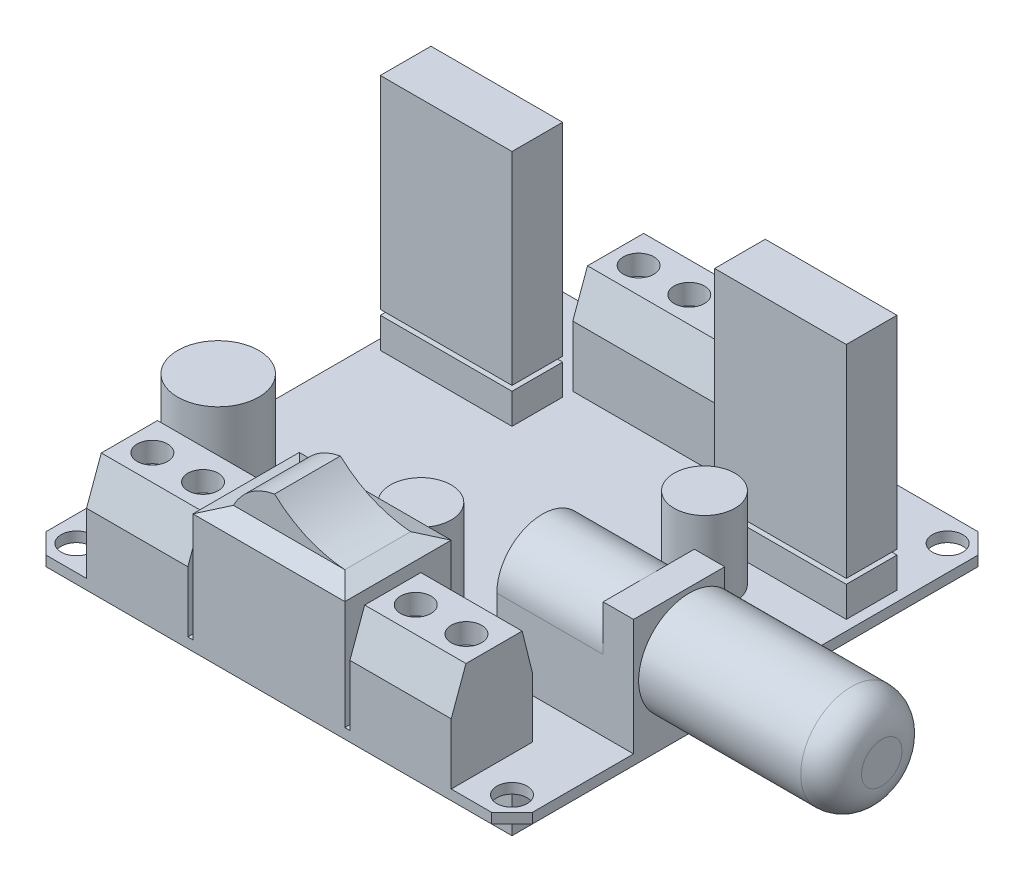
from build123d import *

# Parameters (mm, degrees)
SKETCH_2_W           = 48
SKETCH_2_H           = 48
SKETCH_2_R           = 1.5
EXTRUDE_1_DEPTH      = 5
SKETCH_3_W           = 48
SKETCH_3_H           = 48
SKETCH_3_W_2         = 40
SKETCH_3_H_2         = 40
CUT_EXTRUDE_1_DEPTH  = 4
SKETCH_4_W           = 20
SKETCH_4_H           = 8
EXTRUDE_2_DEPTH      = 10
SKETCH_5_R           = 1.5
CUT_EXTRUDE_2_DEPTH  = 2
CHAMFER_1_SIZE       = 4
CHAMFER_1_SIZE2      = 1.000278651
CHAMFER_2_SIZE       = 4
CHAMFER_2_SIZE2      = 1.455880937
SKETCH_11_W          = 13.5
SKETCH_11_H          = 9
EXTRUDE_5_DEPTH      = 11.5
CUT_EXTRUDE_3_DEPTH  = 10.5
SKETCH_13_R          = 2.25
EXTRUDE_7_DEPTH      = 1
SKETCH_14_R          = 5
EXTRUDE_8_DEPTH      = 19
FILLET_1_R           = 3
SKETCH_15_W          = 15
SKETCH_15_H          = 10.5
EXTRUDE_9_DEPTH      = 11.5
CHAMFER_3_SIZE       = 2
CHAMFER_3_SIZE2      = 0.727940469
SKETCH_16_W          = 11
SKETCH_16_H          = 6.5
EXTRUDE_10_DEPTH     = 3
CUT_EXTRUDE_4_REACH  = 68.575
SKETCH_18_W          = 10
SKETCH_18_H          = 8
EXTRUDE_11_DEPTH     = 10
SKETCH_19_R          = 1.5
CUT_EXTRUDE_5_DEPTH  = 2
CHAMFER_4_SIZE       = 4
CHAMFER_4_SIZE2      = 0.997312011
CHAMFER_5_SIZE       = 4
CHAMFER_5_SIZE2      = 1.455880937
MIRROR_START         = 5
MIRROR_3_OUTLINE_W   = 10
MIRROR_3_OUTLINE_H   = 8
MIRROR_3_DEPTH       = 6
MIRROR_START_2       = 10.766127047
MIRROR_3_2_OUTLINE_R = 1.5
MIRROR_3_2_DEPTH     = 2.233872953
MIRROR_START_3       = -18
MIRROR_3_3_DEPTH     = 10
MIRROR_START_4       = 13
MIRROR_3_4_OUTLINE_R = 1.5
MIRROR_3_4_DEPTH     = 2
SKETCH_20_W          = 13
SKETCH_20_H          = 5
EXTRUDE_12_DEPTH     = 3
SKETCH_21_W          = 0.6
SKETCH_21_H          = 0.8
EXTRUDE_13_DEPTH     = 5.5
SKETCH_22_R          = 4
EXTRUDE_14_DEPTH     = 10
SKETCH_23_R          = 3
EXTRUDE_15_DEPTH     = 8
CHAMFER_6_SIZE       = 2
SKETCH_25_W          = 13
SKETCH_25_H          = 5
EXTRUDE_17_DEPTH     = 20


with BuildPart() as part:
    # 草图2 → 凸台-拉伸1 (new body)
    with BuildSketch(Plane(origin=(0, 0, 0), x_dir=(1, 0, 0), z_dir=(0, 1, 0))):
        Rectangle(SKETCH_2_W, SKETCH_2_H)
        with Locations(Location((-21.5, 21.5, 0), (0, 0, 270))):
            Circle(SKETCH_2_R, mode=Mode.SUBTRACT)
        with Locations(Location((21.5, 21.5, 0), (0, 0, 270))):
            Circle(SKETCH_2_R, mode=Mode.SUBTRACT)
        with Locations(Location((-21.5, -21.5, 0), (0, 0, 270))):
            Circle(SKETCH_2_R, mode=Mode.SUBTRACT)
        with Locations(Location((21.5, -21.5, 0), (0, 0, 270))):
            Circle(SKETCH_2_R, mode=Mode.SUBTRACT)
    extrude(amount=EXTRUDE_1_DEPTH)

    # 草图3 → 切除-拉伸1 (cut)
    with BuildSketch(Plane.XZ):
        Rectangle(SKETCH_3_W, SKETCH_3_H)
        Rectangle(SKETCH_3_W_2, SKETCH_3_H_2, mode=Mode.SUBTRACT)
    extrude(amount=-CUT_EXTRUDE_1_DEPTH, mode=Mode.SUBTRACT)

    # 草图4 → 凸台-拉伸2 (add)
    with BuildSketch(Plane(origin=(0, 5, 0), x_dir=(1, 0, 0), z_dir=(0, 1, 0))):
        with Locations((0, 20)):
            Rectangle(SKETCH_4_W, SKETCH_4_H)
    extrude(amount=EXTRUDE_2_DEPTH)

    # 草图5 → 切除-拉伸2 (cut)
    with BuildSketch(Plane(origin=(0, 15, 0), x_dir=(1, 0, 0), z_dir=(0, 1, 0))):
        with Locations(Location((-7.5, 20, 0), (0, 0, 270))):
            Circle(SKETCH_5_R)
        with Locations(Location((-2.5, 20, 0), (0, 0, 270))):
            Circle(SKETCH_5_R)
        with Locations(Location((2.5, 20, 0), (0, 0, 270))):
            Circle(SKETCH_5_R)
        with Locations(Location((7.5, 20, 0), (0, 0, 270))):
            Circle(SKETCH_5_R)
    extrude(amount=-CUT_EXTRUDE_2_DEPTH, mode=Mode.SUBTRACT)

    # 倒角1
    chamfer_1_edges = [part.edges().sort_by_distance(p)[0] for p in [
        (0, 15, -24),
    ]]
    chamfer_1_side = [part.faces().sort_by_distance(p)[0] for p in [
        (0, 8.935483871, -24),
    ]]
    chamfer(chamfer_1_edges, length=CHAMFER_1_SIZE, length2=CHAMFER_1_SIZE2, reference=chamfer_1_side[0])

    # 倒角2
    chamfer_2_edges = [part.edges().sort_by_distance(p)[0] for p in [
        (0, 15, -16),
    ]]
    chamfer_2_side = [part.faces().sort_by_distance(p)[0] for p in [
        (0, 10, -16),
    ]]
    chamfer(chamfer_2_edges, length=CHAMFER_2_SIZE, length2=CHAMFER_2_SIZE2, reference=chamfer_2_side[0])

    # 草图11 → 凸台-拉伸5 (add)
    with BuildSketch(Plane(origin=(0, 5, 0), x_dir=(1, 0, 0), z_dir=(0, 1, 0))):
        with Locations((17.25, -7.5)):
            Rectangle(SKETCH_11_W, SKETCH_11_H)
    extrude(amount=EXTRUDE_5_DEPTH)

    # 草图12 → 切除-拉伸3 (cut)
    with BuildSketch(Plane.ZY.offset(-10.5)):
        with BuildLine():
            ThreePointArc((7.5, 16.5), (10.681980515, 15.181980515), (12, 12))
            Line((12, 12), (12, 16.5))
            Line((12, 16.5), (7.5, 16.5))
        make_face()
        with BuildLine():
            Line((3, 16.5), (3, 12))
            ThreePointArc((3, 12), (4.318019485, 15.181980515), (7.5, 16.5))
            Line((7.5, 16.5), (3, 16.5))
        make_face()
    extrude(amount=-CUT_EXTRUDE_3_DEPTH, mode=Mode.SUBTRACT)

    # 草图13 → 凸台-拉伸7 (add)
    with BuildSketch(Plane(origin=(24, 0, 0), x_dir=(0, 0, -1), z_dir=(1, 0, 0))):
        with Locations(Location((-7.5, 12, 0), (0, 0, 180))):
            Circle(SKETCH_13_R)
    extrude(amount=EXTRUDE_7_DEPTH)

    # 草图14 → 凸台-拉伸8 (add)
    with BuildSketch(Plane(origin=(25, 0, 0), x_dir=(0, 0, -1), z_dir=(1, 0, 0))):
        with Locations((-7.5, 12)):
            Circle(SKETCH_14_R)
    extrude(amount=EXTRUDE_8_DEPTH)

    # 圆角1
    fillet_1_edges = [part.edges().sort_by_distance(p)[0] for p in [
        (44, 12, 12.5),
    ]]
    fillet(fillet_1_edges, radius=FILLET_1_R)

    # 草图15 → 凸台-拉伸9 (add)
    with BuildSketch(Plane(origin=(0, 5, 0), x_dir=(1, 0, 0), z_dir=(0, 1, 0))):
        with Locations((0, -18.75)):
            Rectangle(SKETCH_15_W, SKETCH_15_H)
    extrude(amount=EXTRUDE_9_DEPTH)

    # 倒角3
    chamfer_3_edges = [part.edges().sort_by_distance(p)[0] for p in [
        (-7.5, 16.5, 18.75),
        (0, 16.5, 24),
        (7.5, 16.5, 18.75),
        (0, 16.5, 13.5),
    ]]
    chamfer_3_side = [part.faces().sort_by_distance(p)[0] for p in [
        (0, 16.5, 18.75),
    ]]
    chamfer(chamfer_3_edges, length=CHAMFER_3_SIZE, length2=CHAMFER_3_SIZE2, reference=chamfer_3_side[0])

    # 草图16 → 凸台-拉伸10 (add)
    with BuildSketch(Plane(origin=(0, 16.5, 0), x_dir=(1, 0, 0), z_dir=(0, 1, 0))):
        with Locations((0, -18.75)):
            Rectangle(SKETCH_16_W, SKETCH_16_H)
    extrude(amount=EXTRUDE_10_DEPTH)

    # 草图17 → 切除-拉伸4 (cut, up to next)
    with BuildSketch(Plane.XY.offset(22), mode=Mode.PRIVATE) as cut_extrude_4_sk1:
        with BuildLine():
            Line((-5.5, 19.5), (-5.5, 16.5))
            add(Edge.make_bspline(
                [(-1.439483258, 19.5), (-4.204331389, 18.963135073), (-5.5, 16.5)],
                knots=[0, 0, 0, 1, 1, 1], degree=2))
            Line((-1.439483258, 19.5), (-5.5, 19.5))
        make_face()
    cut_extrude_4_tool1 = extrude(cut_extrude_4_sk1.sketch, amount=-CUT_EXTRUDE_4_REACH, mode=Mode.PRIVATE) & part.part
    # 草图17 → 切除-拉伸4 (cut, up to next)
    with BuildSketch(Plane.XY.offset(22), mode=Mode.PRIVATE) as cut_extrude_4_sk2:
        with BuildLine():
            add(Edge.make_bspline(
                [(-1.439483258, 19.5), (1.468647393, 16.819501046), (5.5, 16.5)],
                knots=[0, 0, 0, 1, 1, 1], degree=2))
            Line((5.5, 16.5), (5.5, 19.5))
            Line((5.5, 19.5), (-1.439483258, 19.5))
        make_face()
    cut_extrude_4_tool2 = extrude(cut_extrude_4_sk2.sketch, amount=-CUT_EXTRUDE_4_REACH, mode=Mode.PRIVATE) & part.part
    add(cut_extrude_4_tool1.solids().sort_by_distance((-4.412969, 18.65459, 22))[0], mode=Mode.SUBTRACT)
    add(cut_extrude_4_tool2.solids().sort_by_distance((2.881938, 18.323125, 22))[0], mode=Mode.SUBTRACT)

    # 草图18 → 凸台-拉伸11 (add)
    with BuildSketch(Plane(origin=(0, 5, 0), x_dir=(1, 0, 0), z_dir=(0, 1, 0))):
        with Locations((13, -20)):
            Rectangle(SKETCH_18_W, SKETCH_18_H)
    extrude(amount=EXTRUDE_11_DEPTH)

    # 草图19 → 切除-拉伸5 (cut)
    with BuildSketch(Plane(origin=(0, 15, 0), x_dir=(1, 0, 0), z_dir=(0, 1, 0))):
        with Locations(Location((10.5, -20, 0), (0, 0, 270))):
            Circle(SKETCH_19_R)
        with Locations(Location((15.5, -20, 0), (0, 0, 270))):
            Circle(SKETCH_19_R)
    extrude(amount=-CUT_EXTRUDE_5_DEPTH, mode=Mode.SUBTRACT)

    # 倒角4
    chamfer_4_edges = [part.edges().sort_by_distance(p)[0] for p in [
        (13, 15, 16),
    ]]
    chamfer_4_side = [part.faces().sort_by_distance(p)[0] for p in [
        (13, 10, 16),
    ]]
    chamfer(chamfer_4_edges, length=CHAMFER_4_SIZE, length2=CHAMFER_4_SIZE2, reference=chamfer_4_side[0])

    # 倒角5
    chamfer_5_edges = [part.edges().sort_by_distance(p)[0] for p in [
        (13, 15, 24),
    ]]
    chamfer_5_side = [part.faces().sort_by_distance(p)[0] for p in [
        (4.199225564, 9.348716377, 24),
    ]]
    chamfer(chamfer_5_edges, length=CHAMFER_5_SIZE, length2=CHAMFER_5_SIZE2, reference=chamfer_5_side[0])

    # 镜向3: read off the stored shape, not the designer's step
    # 镜向3 outline → 镜向3 (add)
    with BuildSketch(Plane(origin=(0, 0, 0), x_dir=(1, 0, 0), z_dir=(0, 1, 0)).offset(MIRROR_START)):
        with Locations((-13, -20)):
            Rectangle(MIRROR_3_OUTLINE_W, MIRROR_3_OUTLINE_H)
    extrude(amount=MIRROR_3_DEPTH)

    # Mirror 3 2 outline → Mirror 3 2 (add)
    with BuildSketch(Plane(origin=(0, 0, 0), x_dir=(1, 0, 0), z_dir=(0, 1, 0)).offset(MIRROR_START_2)):
        with Locations((-15.5, -20)):
            Circle(MIRROR_3_2_OUTLINE_R)
        with Locations((-10.5, -20)):
            Circle(MIRROR_3_2_OUTLINE_R)
    extrude(amount=MIRROR_3_2_DEPTH)

    # Mirror 3 3 outline → Mirror 3 3 (add)
    with BuildSketch(Plane.YZ.offset(MIRROR_START_3)):
        Polygon((15, 16.997312011), (15, 22.544119063), (11, 24), (11, 16), align=None)
    extrude(amount=MIRROR_3_3_DEPTH)

    # Mirror 3 4 outline → Mirror 3 4 (cut)
    with BuildSketch(Plane(origin=(0, 0, 0), x_dir=(1, 0, 0), z_dir=(0, 1, 0)).offset(MIRROR_START_4)):
        with Locations((-15.5, -20)):
            Circle(MIRROR_3_4_OUTLINE_R)
        with Locations((-10.5, -20)):
            Circle(MIRROR_3_4_OUTLINE_R)
    extrude(amount=MIRROR_3_4_DEPTH, mode=Mode.SUBTRACT)

    # 草图20 → 凸台-拉伸12 (add)
    with BuildSketch(Plane(origin=(0, 5, 0), x_dir=(1, 0, 0), z_dir=(0, 1, 0))):
        with Locations((-16.5, 12.5)):
            Rectangle(SKETCH_20_W, SKETCH_20_H)
    extrude_12 = extrude(amount=EXTRUDE_12_DEPTH)

    # 草图21 → 凸台-拉伸13 (add)
    with BuildSketch(Plane(origin=(0, 8, 0), x_dir=(1, 0, 0), z_dir=(0, 1, 0))):
        with Locations((-21.825518911, 13.9)):
            Rectangle(SKETCH_21_W, SKETCH_21_H)
        with Locations((-19.285518911, 13.9)):
            Rectangle(SKETCH_21_W, SKETCH_21_H)
        with Locations((-16.745518911, 13.9)):
            Rectangle(SKETCH_21_W, SKETCH_21_H)
        with Locations((-14.205518911, 13.9)):
            Rectangle(SKETCH_21_W, SKETCH_21_H)
        with Locations((-11.665518911, 13.9)):
            Rectangle(SKETCH_21_W, SKETCH_21_H)
        with Locations((-19.285518911, 11.4)):
            Rectangle(SKETCH_21_W, SKETCH_21_H)
        with Locations((-16.745518911, 11.4)):
            Rectangle(SKETCH_21_W, SKETCH_21_H)
        with Locations((-14.205518911, 11.4)):
            Rectangle(SKETCH_21_W, SKETCH_21_H)
        with Locations((-11.665518911, 11.4)):
            Rectangle(SKETCH_21_W, SKETCH_21_H)
        with Locations((-21.825518911, 11.4)):
            Rectangle(SKETCH_21_W, SKETCH_21_H)
    extrude_13 = extrude(amount=EXTRUDE_13_DEPTH)

    # 镜向4: 凸台-拉伸12, 凸台-拉伸13 across plane
    add(extrude_12.mirror(Plane(origin=(0, 0, 0), x_dir=(0, 0, 1), z_dir=(1, 0, 0))))
    add(extrude_13.mirror(Plane(origin=(0, 0, 0), x_dir=(0, 0, 1), z_dir=(1, 0, 0))))

    # 草图22 → 凸台-拉伸14 (add)
    with BuildSketch(Plane(origin=(0, 5, 0), x_dir=(1, 0, 0), z_dir=(0, 1, 0))):
        with Locations(Location((-19, -10, 0), (0, 0, 270))):
            Circle(SKETCH_22_R)
    extrude(amount=EXTRUDE_14_DEPTH)

    # 草图23 → 凸台-拉伸15 (add)
    with BuildSketch(Plane(origin=(0, 5, 0), x_dir=(1, 0, 0), z_dir=(0, 1, 0))):
        with Locations(Location((0, -9, 0), (0, 0, 270))):
            Circle(SKETCH_23_R)
        with Locations(Location((13, 6, 0), (0, 0, 270))):
            Circle(SKETCH_23_R)
    extrude(amount=EXTRUDE_15_DEPTH)

    # 倒角6
    chamfer_6_edges = [part.edges().sort_by_distance(p)[0] for p in [
        (24, 4.5, 24),
        (-24, 4.5, 24),
        (-24, 4.5, -24),
        (24, 4.5, -24),
    ]]
    chamfer(chamfer_6_edges, length=CHAMFER_6_SIZE)

    # 草图25 → 凸台-拉伸17 (add)
    with BuildSketch(Plane(origin=(0, 8.5, 0), x_dir=(1, 0, 0), z_dir=(0, 1, 0))):
        with Locations((16.5, 12.5)):
            Rectangle(SKETCH_25_W, SKETCH_25_H)
    extrude_17 = extrude(amount=EXTRUDE_17_DEPTH)

    # 镜向5: 凸台-拉伸17 across plane
    add(extrude_17.mirror(Plane(origin=(0, 0, 0), x_dir=(0, 0, 1), z_dir=(1, 0, 0))))


solid = part.part
